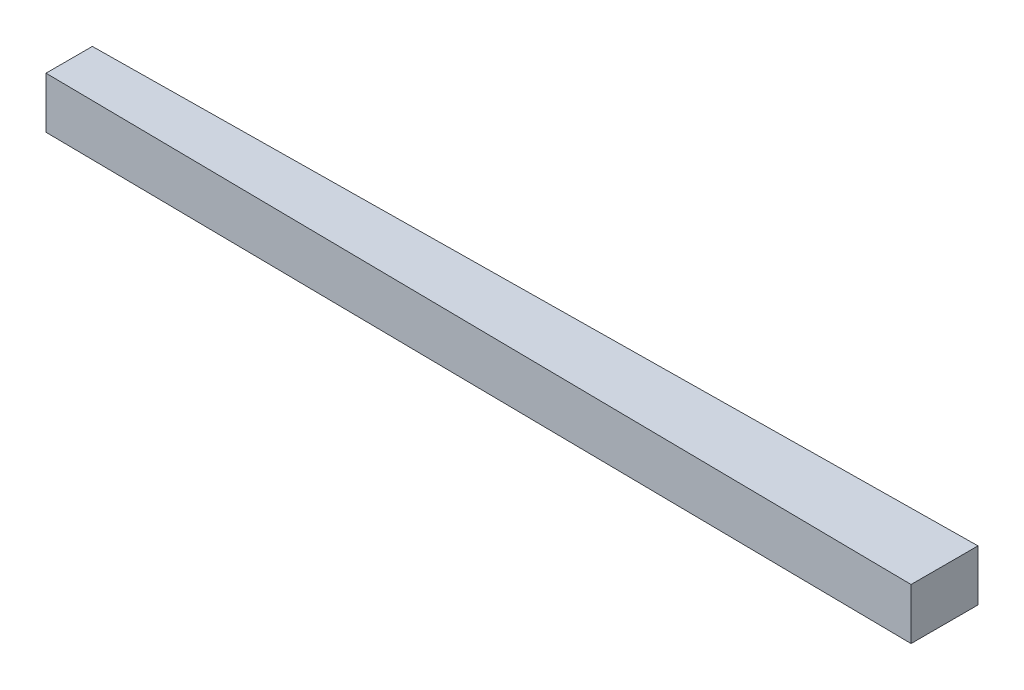
from build123d import *

# Parameters (mm, degrees)
BOSS_EXTRUDE1_DEPTH = 4.97


with BuildPart() as part:
    # Sketch1 → Boss-Extrude1 (new body)
    with BuildSketch(Plane(origin=(0, 0, 0), x_dir=(1, 0, 0), z_dir=(0, 1, 0))):
        Polygon((-42.5, -2.25), (-42.5, 2.25), (42.5, 3.25), (42.5, -3.25), align=None)
    extrude(amount=BOSS_EXTRUDE1_DEPTH)


solid = part.part
